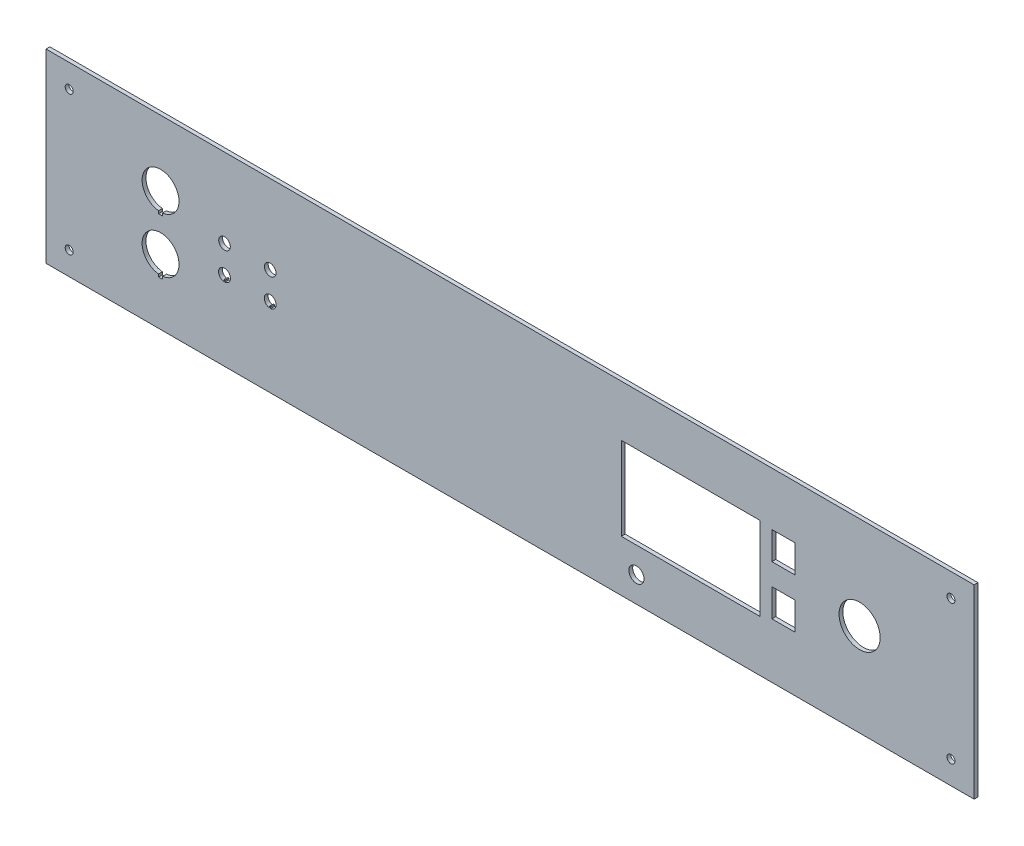
from build123d import *

# Parameters (mm, degrees)
SKETCH1_W             = 508
SKETCH1_H             = 101.6
FRONT_PANEL_DEPTH     = 2.1
MOUNTING_HOLES_REACH  = 261.039
SKETCH7_R             = 2.2
START_STOP_DEPTH      = 260.038703672
SKETCH3_R             = 3.175
MODE_SELECT_DEPTH     = 260.038703672
SKETCH4_W             = 76
SKETCH4_H             = 45.5
LCD_CUTOUT_DEPTH      = 260.038703672
SKETCH5_R             = 11.25
E_STOP_CUTOUT_DEPTH   = 260.038703672
SKETCH6_W             = 12.7
SKETCH6_H             = 15.24
LCD_PUSHBUTTONS_DEPTH = 260.038703672
ERROR_INDICATOR_REACH = 261.039
SKETCH8_R             = 4.15


with BuildPart() as part:
    # Sketch1 → Front panel (new body)
    with BuildSketch(Plane.XY):
        Rectangle(SKETCH1_W, SKETCH1_H)
    extrude(amount=FRONT_PANEL_DEPTH)

    # Sketch7 → Mounting holes (cut, up to next)
    with BuildSketch(Plane.XY.offset(2.1), mode=Mode.PRIVATE) as mounting_holes_sk1:
        with Locations((-241.3, 38.1)):
            Circle(SKETCH7_R)
    mounting_holes_tool1 = extrude(mounting_holes_sk1.sketch, amount=-MOUNTING_HOLES_REACH, mode=Mode.PRIVATE) & part.part
    # Sketch7 → Mounting holes (cut, up to next)
    with BuildSketch(Plane.XY.offset(2.1), mode=Mode.PRIVATE) as mounting_holes_sk2:
        with Locations((-241.3, -38.1)):
            Circle(SKETCH7_R)
    mounting_holes_tool2 = extrude(mounting_holes_sk2.sketch, amount=-MOUNTING_HOLES_REACH, mode=Mode.PRIVATE) & part.part
    # Sketch7 → Mounting holes (cut, up to next)
    with BuildSketch(Plane.XY.offset(2.1), mode=Mode.PRIVATE) as mounting_holes_sk3:
        with Locations((241.3, -38.1)):
            Circle(SKETCH7_R)
    mounting_holes_tool3 = extrude(mounting_holes_sk3.sketch, amount=-MOUNTING_HOLES_REACH, mode=Mode.PRIVATE) & part.part
    # Sketch7 → Mounting holes (cut, up to next)
    with BuildSketch(Plane.XY.offset(2.1), mode=Mode.PRIVATE) as mounting_holes_sk4:
        with Locations((241.3, 38.1)):
            Circle(SKETCH7_R)
    mounting_holes_tool4 = extrude(mounting_holes_sk4.sketch, amount=-MOUNTING_HOLES_REACH, mode=Mode.PRIVATE) & part.part
    add(mounting_holes_tool1.solids().sort_by_distance((-241.3, 38.1, 2.1))[0], mode=Mode.SUBTRACT)
    add(mounting_holes_tool2.solids().sort_by_distance((-241.3, -38.1, 2.1))[0], mode=Mode.SUBTRACT)
    add(mounting_holes_tool3.solids().sort_by_distance((241.3, -38.1, 2.1))[0], mode=Mode.SUBTRACT)
    add(mounting_holes_tool4.solids().sort_by_distance((241.3, 38.1, 2.1))[0], mode=Mode.SUBTRACT)

    # Sketch2 → Start/stop (cut, through all)
    with BuildSketch(Plane.XY.offset(2.1)):
        with BuildLine():
            Line((-192.4, 4.960079682), (-192.4, 3.5))
            Line((-192.4, 3.5), (-190.2, 3.5))
            Line((-190.2, 3.5), (-190.2, 4.960079682))
            ThreePointArc((-190.2, 4.960079682), (-191.3, 25.1), (-192.4, 4.960079682))
        make_face()
        with BuildLine():
            Line((-192.4, -25.039920318), (-192.4, -26.5))
            Line((-192.4, -26.5), (-190.2, -26.5))
            Line((-190.2, -26.5), (-190.2, -25.039920318))
            ThreePointArc((-190.2, -25.039920318), (-191.3, -4.9), (-192.4, -25.039920318))
        make_face()
    extrude(amount=-START_STOP_DEPTH, mode=Mode.SUBTRACT)

    # Sketch3 → Mode select (cut, through all)
    with BuildSketch(Plane.XY.offset(2.1)):
        with Locations((-156.3, 7.5)):
            Circle(SKETCH3_R)
        with Locations((-131.3, 7.5)):
            Circle(SKETCH3_R)
        with BuildLine():
            Line((-156.6, -10.736124225), (-156.6, -9.85))
            Line((-156.6, -9.85), (-156, -9.85))
            Line((-156, -9.85), (-156, -10.736124225))
            ThreePointArc((-156, -10.736124225), (-156.3, -4.25), (-156.6, -10.736124225))
        make_face()
        with BuildLine():
            Line((-131.6, -10.736124225), (-131.6, -9.85))
            Line((-131.6, -9.85), (-131, -9.85))
            Line((-131, -9.85), (-131, -10.736124225))
            ThreePointArc((-131, -10.736124225), (-131.3, -4.25), (-131.6, -10.736124225))
        make_face()
    extrude(amount=-MODE_SELECT_DEPTH, mode=Mode.SUBTRACT)

    # Sketch4 → LCD cutout (cut, through all)
    with BuildSketch(Plane.XY.offset(2.1)):
        with Locations((98.860146723, 0)):
            Rectangle(SKETCH4_W, SKETCH4_H)
    extrude(amount=-LCD_CUTOUT_DEPTH, mode=Mode.SUBTRACT)

    # Sketch5 → E-stop cutout (cut, through all)
    with BuildSketch(Plane.XY.offset(2.1)):
        with Locations((191.3, 0)):
            Circle(SKETCH5_R)
    extrude(amount=-E_STOP_CUTOUT_DEPTH, mode=Mode.SUBTRACT)

    # Sketch6 → LCD pushbuttons (cut, through all)
    with BuildSketch(Plane.XY.offset(2.1)):
        with Locations((149.670146723, 14.0825)):
            Rectangle(SKETCH6_W, SKETCH6_H)
        with Locations((149.670146723, -13.035)):
            Rectangle(SKETCH6_W, SKETCH6_H)
    extrude(amount=-LCD_PUSHBUTTONS_DEPTH, mode=Mode.SUBTRACT)

    # Sketch8 → ERROR indicator (cut, up to next)
    with BuildSketch(Plane.XY.offset(2.1), mode=Mode.PRIVATE) as error_indicator_sk1:
        with Locations((69.160146723, -36.775)):
            Circle(SKETCH8_R)
    error_indicator_tool1 = extrude(error_indicator_sk1.sketch, amount=-ERROR_INDICATOR_REACH, mode=Mode.PRIVATE) & part.part
    add(error_indicator_tool1.solids().sort_by_distance((69.160147, -36.775, 2.1))[0], mode=Mode.SUBTRACT)


solid = part.part
